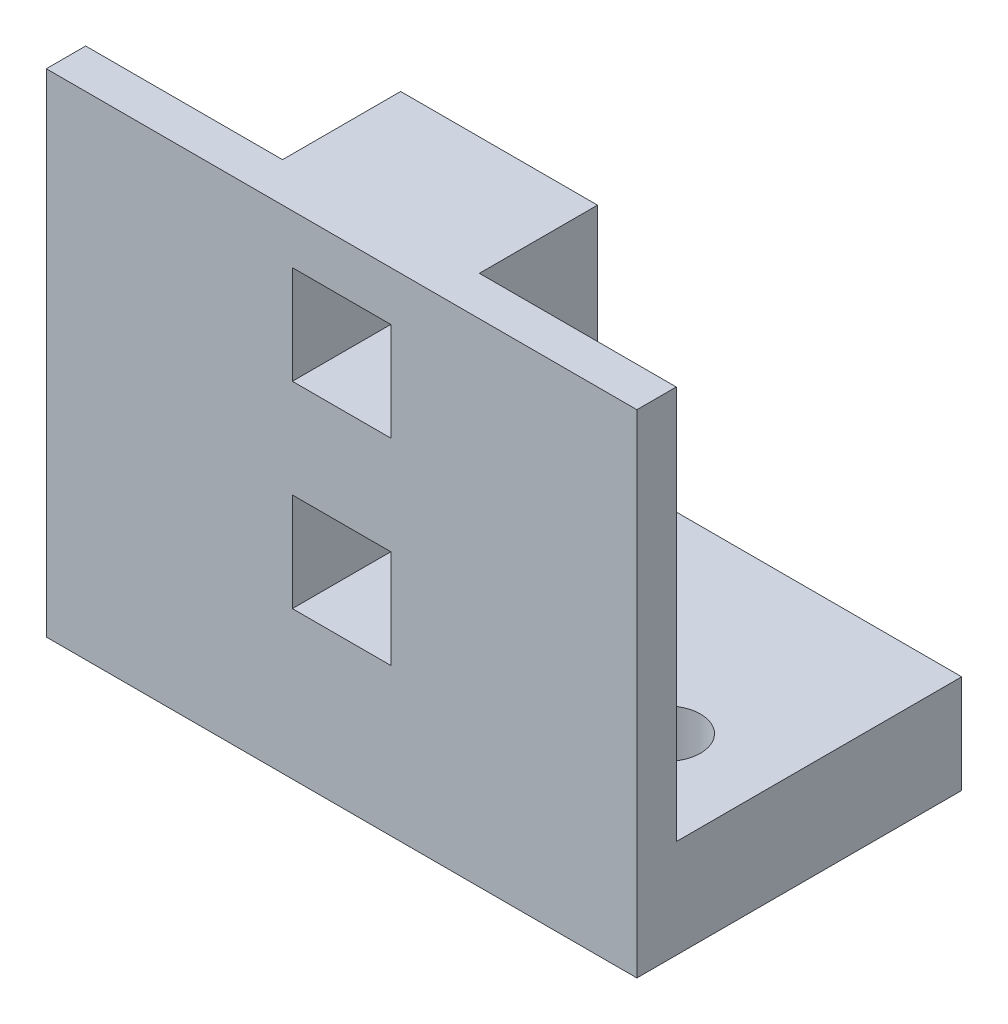
from build123d import *

# Parameters (mm, degrees)
SKETCH1_W           = 30
SKETCH1_H           = 16.5
SKETCH1_R           = 1.651360784
SKETCH1_R_2         = 1.728305727
BOSS_EXTRUDE1_DEPTH = 5
SKETCH2_W           = 30
SKETCH2_H           = 20
BOSS_EXTRUDE2_DEPTH = 2
SKETCH3_W           = 5
SKETCH3_H           = 5
CUT_EXTRUDE1_DEPTH  = 33.56148031
SKETCH4_W           = 10
SKETCH4_H           = 20
SKETCH4_W_2         = 5
SKETCH4_H_2         = 5
BOSS_EXTRUDE3_DEPTH = 4
SKETCH5_W           = 10
SKETCH5_H           = 20
BOSS_EXTRUDE4_DEPTH = 2


with BuildPart() as part:
    # Sketch1 → Boss-Extrude1 (new body)
    with BuildSketch(Plane(origin=(0, 0, 0), x_dir=(1, 0, 0), z_dir=(0, 1, 0))):
        Rectangle(SKETCH1_W, SKETCH1_H)
        with Locations((-10, -1.75)):
            Circle(SKETCH1_R, mode=Mode.SUBTRACT)
        with Locations((10, -1.75)):
            Circle(SKETCH1_R_2, mode=Mode.SUBTRACT)
    extrude(amount=BOSS_EXTRUDE1_DEPTH)

    # Sketch2 → Boss-Extrude2 (add)
    with BuildSketch(Plane.XY.offset(8.25)):
        with Locations((0, 15)):
            Rectangle(SKETCH2_W, SKETCH2_H)
    extrude(amount=-BOSS_EXTRUDE2_DEPTH)

    # Sketch3 → Cut-Extrude1 (cut, through all)
    with BuildSketch(Plane(origin=(0, 0, 6.25), x_dir=(-1, 0, 0), z_dir=(0, 0, -1))):
        with Locations((0, 10)):
            Rectangle(SKETCH3_W, SKETCH3_H)
        with Locations((0, 20)):
            Rectangle(SKETCH3_W, SKETCH3_H)
    extrude(amount=-CUT_EXTRUDE1_DEPTH, mode=Mode.SUBTRACT)

    # Sketch4 → Boss-Extrude3 (add)
    with BuildSketch(Plane(origin=(0, 0, 6.25), x_dir=(-1, 0, 0), z_dir=(0, 0, -1))):
        with Locations((0, 15)):
            Rectangle(SKETCH4_W, SKETCH4_H)
        with Locations((0, 20)):
            Rectangle(SKETCH4_W_2, SKETCH4_H_2, mode=Mode.SUBTRACT)
        with Locations((0, 10)):
            Rectangle(SKETCH4_W_2, SKETCH4_H_2, mode=Mode.SUBTRACT)
    extrude(amount=BOSS_EXTRUDE3_DEPTH)

    # Sketch5 → Boss-Extrude4 (add)
    with BuildSketch(Plane(origin=(0, 0, 2.25), x_dir=(-1, 0, 0), z_dir=(0, 0, -1))):
        with Locations((0, 15)):
            Rectangle(SKETCH5_W, SKETCH5_H)
    extrude(amount=BOSS_EXTRUDE4_DEPTH)


solid = part.part
